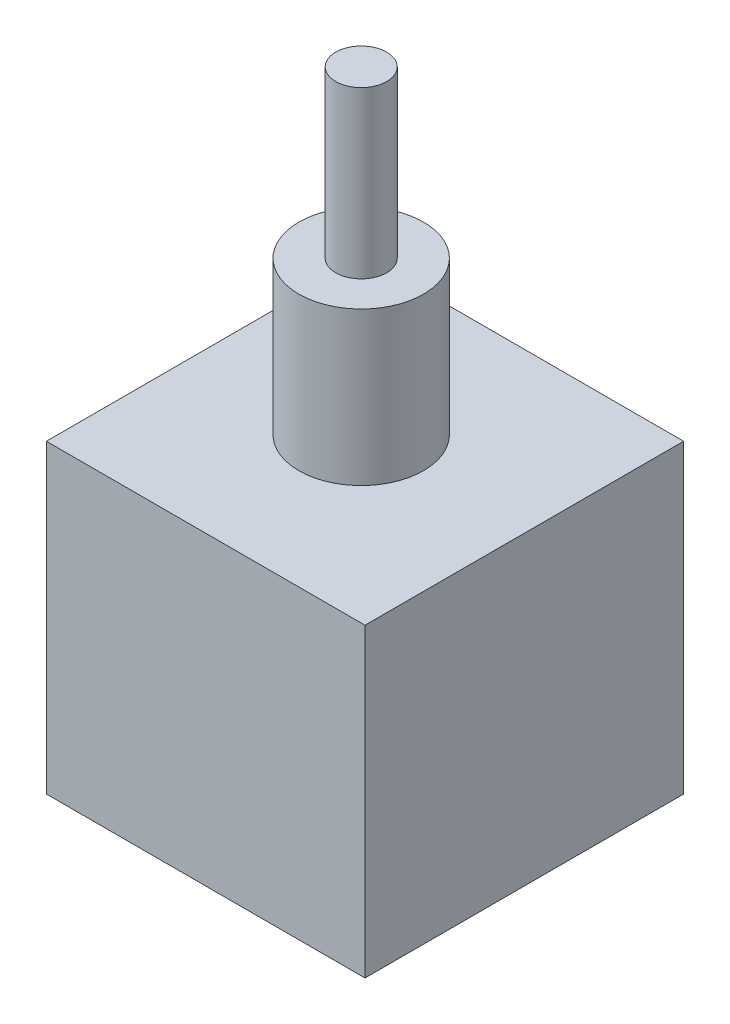
from build123d import *

# Parameters (mm, degrees)
SKETCH_1_W        = 30
SKETCH_1_H        = 30
EXTRUDE_276_DEPTH = 28.77
SKETCH_2_R        = 5.875
EXTRUDE_2_DEPTH   = 14.4
SKETCH_4_R        = 2.4
EXTRUDE_3_DEPTH   = 15.6


with BuildPart() as part:
    # Эскиз1 → Extrude 276 (new body)
    with BuildSketch(Plane(origin=(0, 0, 0), x_dir=(1, 0, 0), z_dir=(0, 1, 0))):
        with Locations((0.713469456, -0.356734728)):
            Rectangle(SKETCH_1_W, SKETCH_1_H)
    extrude(amount=EXTRUDE_276_DEPTH)

    # Эскиз2 → Бобышка-Вытянуть2 (add)
    with BuildSketch(Plane(origin=(0, 28.77, 0), x_dir=(1, 0, 0), z_dir=(0, 1, 0))):
        Circle(SKETCH_2_R)
    extrude(amount=EXTRUDE_2_DEPTH)

    # Эскиз4 → Бобышка-Вытянуть3 (add)
    with BuildSketch(Plane(origin=(0, 43.17, 0), x_dir=(1, 0, 0), z_dir=(0, 1, 0))):
        Circle(SKETCH_4_R)
    extrude(amount=EXTRUDE_3_DEPTH)


solid = part.part
